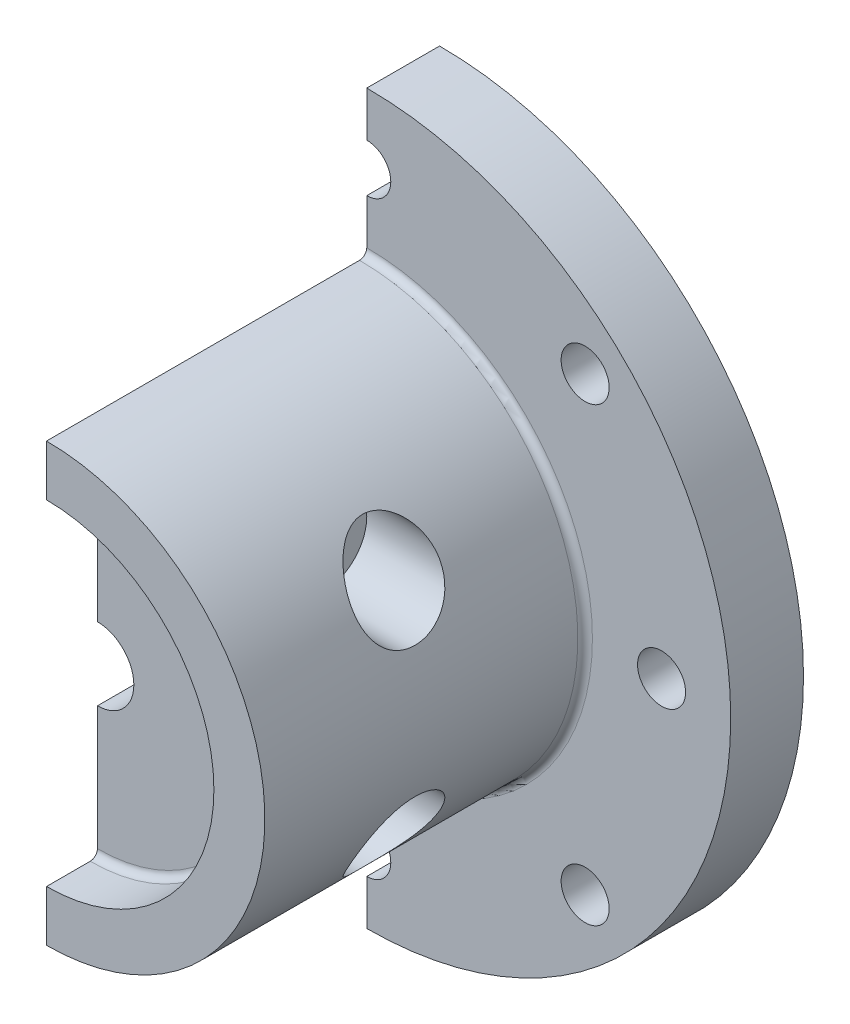
from build123d import *

# Parameters (mm, degrees)
SKETCH_1_R          = 15
EXTRUDE_1_DEPTH     = 22
SKETCH_2_R          = 11.5
CUT_EXTRUDE_1_DEPTH = 3.5
FILLET_1_R          = 0.5
SKETCH_4_R          = 2.5
CUT_EXTRUDE_2_DEPTH = 30
SKETCH_5_R          = 1.65
CUT_EXTRUDE_3_DEPTH = 15
SKETCH_7_R          = 3
CUT_EXTRUDE_4_DEPTH = 7
CUT_EXTRUDE_START   = 7
SKETCH_10_R         = 3
CUT_EXTRUDE_5_DEPTH = 7
SKETCH_12_R         = 25
EXTRUDE_2_DEPTH     = 5
FILLET_2_R          = 0.5
SKETCH_13_R         = 1.65
CUT_EXTRUDE_7_DEPTH = 20
CUT_EXTRUDE_8_DEPTH = 50
SKETCH_15_R         = 2.5
CUT_EXTRUDE_9_DEPTH = 10


with BuildPart() as part:
    # 草图1 → 凸台-拉伸1 (new body)
    with BuildSketch(Plane.XY):
        Circle(SKETCH_1_R)
    extrude(amount=EXTRUDE_1_DEPTH)

    # 草图2 → 切除-拉伸1 (cut)
    with BuildSketch(Plane.XY.offset(22)):
        Circle(SKETCH_2_R)
    extrude(amount=-CUT_EXTRUDE_1_DEPTH, mode=Mode.SUBTRACT)

    # 圆角1
    fillet_1_edges = [part.edges().sort_by_distance(p)[0] for p in [
        (-11.5, 0, 18.5),
    ]]
    fillet(fillet_1_edges, radius=FILLET_1_R)

    # 草图4 → 切除-拉伸2 (cut)
    with BuildSketch(Plane(origin=(0, 0, 0), x_dir=(-1, 0, 0), z_dir=(0, 0, -1))):
        Circle(SKETCH_4_R)
    extrude(amount=-CUT_EXTRUDE_2_DEPTH, mode=Mode.SUBTRACT)

    # 草图5 → 切除-拉伸3 (cut, symmetric)
    with BuildSketch(Plane(origin=(0, 0, 0), x_dir=(0, 0, -1), z_dir=(1, 0, 0))):
        with Locations((-11, -7.5)):
            Circle(SKETCH_5_R)
        with Locations((-11, 7.5)):
            Circle(SKETCH_5_R)
    extrude(amount=CUT_EXTRUDE_3_DEPTH, both=True, mode=Mode.SUBTRACT)

    # 草图7 → 切除-拉伸4 (cut)
    with BuildSketch(Plane(origin=(15, 0, 0), x_dir=(0, 0, -1), z_dir=(1, 0, 0))):
        with Locations((-11, 7.5)):
            Circle(SKETCH_7_R)
        with Locations((-11, -7.5)):
            Circle(SKETCH_7_R)
    extrude(amount=-CUT_EXTRUDE_4_DEPTH, mode=Mode.SUBTRACT)

    # 草图10 → 切除-拉伸5 (cut)
    with BuildSketch(Plane(origin=(-15, 0, 0), x_dir=(0, 0, -1), z_dir=(1, 0, 0)).offset(CUT_EXTRUDE_START)):
        with Locations((-11, 7.5)):
            Circle(SKETCH_10_R)
        with Locations((-11, -7.5)):
            Circle(SKETCH_10_R)
    extrude(amount=-CUT_EXTRUDE_5_DEPTH, mode=Mode.SUBTRACT)

    # 草图12 → 凸台-拉伸2 (add)
    with BuildSketch(Plane(origin=(0, 0, 0), x_dir=(-1, 0, 0), z_dir=(0, 0, -1))):
        Circle(SKETCH_12_R)
    extrude(amount=EXTRUDE_2_DEPTH)

    # 圆角2
    fillet_2_edges = [part.edges().sort_by_distance(p)[0] for p in [
        (-15, 0, 0),
    ]]
    fillet(fillet_2_edges, radius=FILLET_2_R)

    # 草图13 → 切除-拉伸7 (cut)
    with BuildSketch(Plane.XY):
        with Locations((0, 20.25)):
            Circle(SKETCH_13_R)
        with Locations((20.25, 0)):
            Circle(SKETCH_13_R)
        with Locations((0, -20.25)):
            Circle(SKETCH_13_R)
        with Locations((-20.25, 0)):
            Circle(SKETCH_13_R)
        with Locations((15, 15.5)):
            Circle(SKETCH_13_R)
        with Locations((15, -15.5)):
            Circle(SKETCH_13_R)
        with Locations((-15, -15.5)):
            Circle(SKETCH_13_R)
        with Locations((-15, 15.5)):
            Circle(SKETCH_13_R)
    extrude(amount=-CUT_EXTRUDE_7_DEPTH, mode=Mode.SUBTRACT)

    # 草图14 → 切除-拉伸8 (cut, symmetric)
    with BuildSketch(Plane.XY.offset(18.5)):
        with BuildLine():
            ThreePointArc((0, -2.5), (-2.5, 0), (0, 2.5))
            Line((0, 2.5), (0, 25))
            Line((0, 25), (-30.424746284, 25))
            Line((-30.424746284, 25), (-30.99343313, -25))
            Line((-30.99343313, -25), (0, -25))
            Line((0, -25), (0, -2.5))
        make_face()
    extrude(amount=CUT_EXTRUDE_8_DEPTH, both=True, mode=Mode.SUBTRACT)

    # 草图15 → 切除-拉伸9 (cut)
    with BuildSketch(Plane.XY):
        Circle(SKETCH_15_R)
    extrude(amount=-CUT_EXTRUDE_9_DEPTH, mode=Mode.SUBTRACT)


solid = part.part
